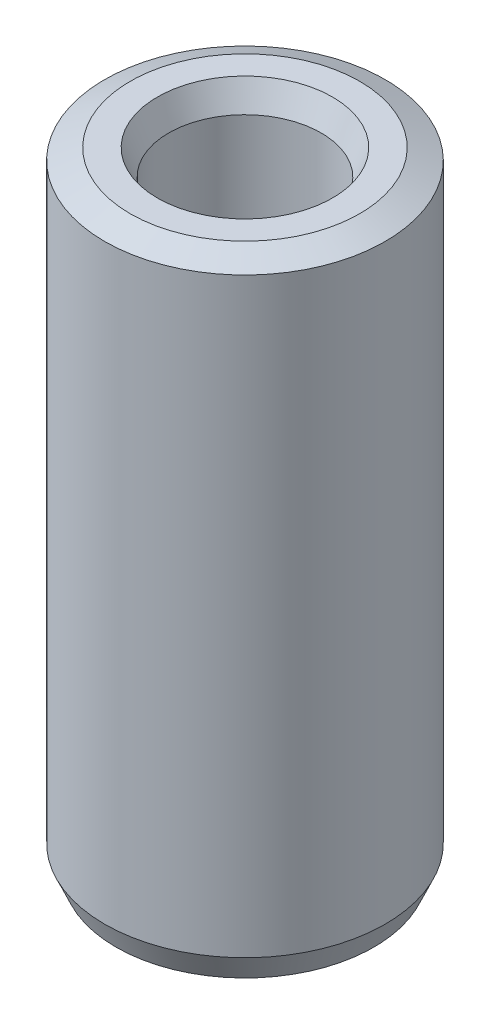
from build123d import *
from OCP.BRepFilletAPI import BRepFilletAPI_MakeChamfer

# Parameters (mm, degrees)
SKETCH1_R           = 7.5
BOSS_EXTRUDE1_DEPTH = 33.583479707
SKETCH2_R           = 4.079687069
CUT_EXTRUDE1_DEPTH  = 36.21860459
CHAMFER1_SIZE       = 0.602436293
CHAMFER1_SIZE2      = 1.36460572


with BuildPart() as part:
    # Sketch1 → Boss-Extrude1 (new body)
    with BuildSketch(Plane(origin=(0, 0, 0), x_dir=(1, 0, 0), z_dir=(0, 1, 0))):
        Circle(SKETCH1_R)
    extrude(amount=BOSS_EXTRUDE1_DEPTH)

    # Sketch2 → Cut-Extrude1 (cut, through all)
    with BuildSketch(Plane(origin=(0, 0, 0), x_dir=(1, 0, 0), z_dir=(0, 1, 0))):
        Circle(SKETCH2_R)
    extrude(amount=CUT_EXTRUDE1_DEPTH, mode=Mode.SUBTRACT)

    # Chamfer1: one chamfer whose edges measure the first distance from different faces: ONE call of the kernel's chamfer builder (chamfer() names one face for all edges)
    chamfer1_edges_1 = [part.edges().sort_by_distance(p)[0] for p in [
        (-4.079687069, 33.583479707, 0),
    ]]
    chamfer1_side_1 = [part.faces().sort_by_distance(p)[0] for p in [
        (-7.287867966, 33.583479707, 0),
    ]]
    chamfer1_edges_2 = [part.edges().sort_by_distance(p)[0] for p in [
        (-4.079687069, 0, 0),
    ]]
    chamfer1_side_2 = [part.faces().sort_by_distance(p)[0] for p in [
        (-4.079687069, 16.791739854, 0),
    ]]
    chamfer1_edges_3 = [part.edges().sort_by_distance(p)[0] for p in [
        (-7.5, 0, 0),
    ]]
    chamfer1_side_3 = [part.faces().sort_by_distance(p)[0] for p in [
        (-7.287867966, 0, 0),
    ]]
    chamfer1_edges_4 = [part.edges().sort_by_distance(p)[0] for p in [
        (-7.5, 33.583479707, 0),
    ]]
    chamfer1_side_4 = [part.faces().sort_by_distance(p)[0] for p in [
        (-7.5, 16.791739854, 0),
    ]]
    chamfer1 = BRepFilletAPI_MakeChamfer(part.part.solid().wrapped)
    for e in chamfer1_edges_1:
        chamfer1.Add(CHAMFER1_SIZE, CHAMFER1_SIZE2, e.wrapped, chamfer1_side_1[0].wrapped)  # the first distance lies on this face
    for e in chamfer1_edges_2:
        chamfer1.Add(CHAMFER1_SIZE, CHAMFER1_SIZE2, e.wrapped, chamfer1_side_2[0].wrapped)  # the first distance lies on this face
    for e in chamfer1_edges_3:
        chamfer1.Add(CHAMFER1_SIZE, CHAMFER1_SIZE2, e.wrapped, chamfer1_side_3[0].wrapped)  # the first distance lies on this face
    for e in chamfer1_edges_4:
        chamfer1.Add(CHAMFER1_SIZE, CHAMFER1_SIZE2, e.wrapped, chamfer1_side_4[0].wrapped)  # the first distance lies on this face
    add(Compound.cast(chamfer1.Shape()), mode=Mode.REPLACE)


solid = part.part
